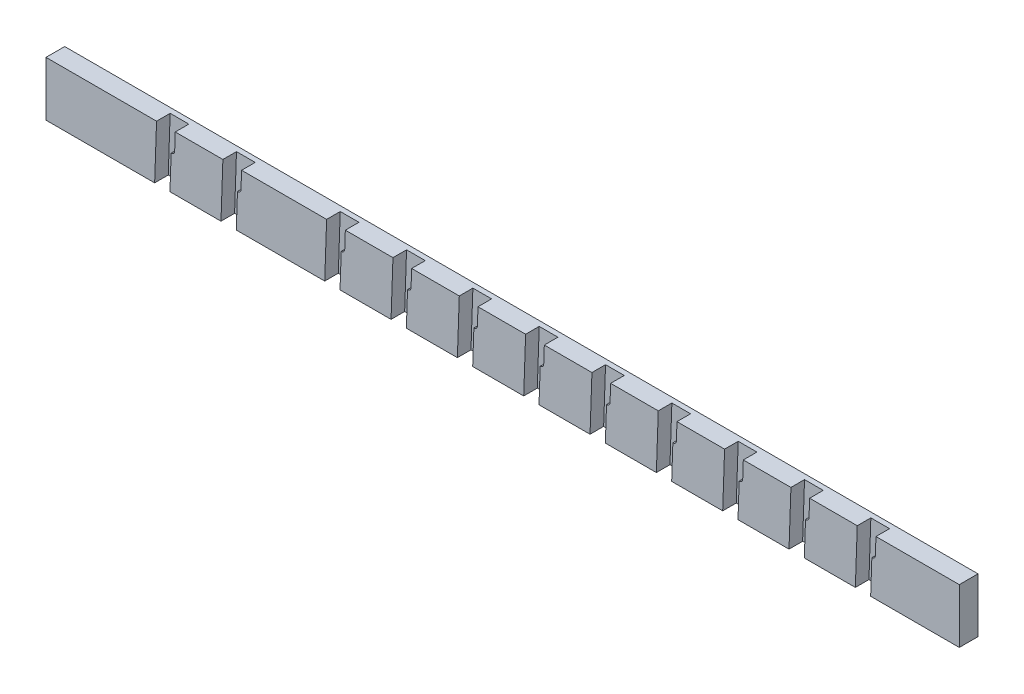
from build123d import *

# Parameters (mm, degrees)
SKETCH1_W           = 1704.975
SKETCH1_H           = 101.6
BOSS_EXTRUDE1_DEPTH = 34.925
CUT_EXTRUDE1_DEPTH  = 25.4


with BuildPart() as part:
    # Sketch1 → Boss-Extrude1 (new body)
    with BuildSketch(Plane.XY):
        Rectangle(SKETCH1_W, SKETCH1_H)
    extrude(amount=BOSS_EXTRUDE1_DEPTH)

    # Sketch2 → Cut-Extrude1 (cut)
    with BuildSketch(Plane.XY.offset(34.925)):
        with BuildLine():
            Line((658.43954982, -50.8), (687.01454982, -50.8))
            Line((687.01454982, -50.8), (689.232018682, 12.7))
            Line((689.232018682, 12.7), (689.449894962, 12.7))
            ThreePointArc((689.449894962, 12.7), (693.860975615, 14.482192268), (695.796026714, 18.828388196))
            Line((695.796026714, 18.828388196), (696.9125, 50.8))
            Line((696.9125, 50.8), (661.9875, 50.8))
            Line((661.9875, 50.8), (658.43954982, -50.8))
        make_face()
        with BuildLine():
            Line((534.61454982, -50.8), (563.18954982, -50.8))
            Line((563.18954982, -50.8), (565.407018682, 12.7))
            Line((565.407018682, 12.7), (565.624894962, 12.7))
            ThreePointArc((565.624894962, 12.7), (570.035975615, 14.482192268), (571.971026714, 18.828388196))
            Line((571.971026714, 18.828388196), (573.0875, 50.8))
            Line((573.0875, 50.8), (538.1625, 50.8))
            Line((538.1625, 50.8), (534.61454982, -50.8))
        make_face()
        with BuildLine():
            Line((410.78954982, -50.8), (439.36454982, -50.8))
            Line((439.36454982, -50.8), (441.582018682, 12.7))
            Line((441.582018682, 12.7), (441.799894962, 12.7))
            ThreePointArc((441.799894962, 12.7), (446.210975615, 14.482192268), (448.146026714, 18.828388196))
            Line((448.146026714, 18.828388196), (449.2625, 50.8))
            Line((449.2625, 50.8), (414.3375, 50.8))
            Line((414.3375, 50.8), (410.78954982, -50.8))
        make_face()
        with BuildLine():
            Line((286.96454982, -50.8), (315.53954982, -50.8))
            Line((315.53954982, -50.8), (317.757018682, 12.7))
            Line((317.757018682, 12.7), (317.974894962, 12.7))
            ThreePointArc((317.974894962, 12.7), (322.385975615, 14.482192268), (324.321026714, 18.828388196))
            Line((324.321026714, 18.828388196), (325.4375, 50.8))
            Line((325.4375, 50.8), (290.5125, 50.8))
            Line((290.5125, 50.8), (286.96454982, -50.8))
        make_face()
        with BuildLine():
            Line((163.13954982, -50.8), (191.71454982, -50.8))
            Line((191.71454982, -50.8), (193.932018682, 12.7))
            Line((193.932018682, 12.7), (194.149894962, 12.7))
            ThreePointArc((194.149894962, 12.7), (198.560975615, 14.482192268), (200.496026714, 18.828388196))
            Line((200.496026714, 18.828388196), (201.6125, 50.8))
            Line((201.6125, 50.8), (166.6875, 50.8))
            Line((166.6875, 50.8), (163.13954982, -50.8))
        make_face()
        with BuildLine():
            Line((39.31454982, -50.8), (67.88954982, -50.8))
            Line((67.88954982, -50.8), (70.107018682, 12.7))
            Line((70.107018682, 12.7), (70.324894962, 12.7))
            ThreePointArc((70.324894962, 12.7), (74.735975615, 14.482192268), (76.671026714, 18.828388196))
            Line((76.671026714, 18.828388196), (77.7875, 50.8))
            Line((77.7875, 50.8), (42.8625, 50.8))
            Line((42.8625, 50.8), (39.31454982, -50.8))
        make_face()
        with BuildLine():
            Line((-84.51045018, -50.8), (-55.93545018, -50.8))
            Line((-55.93545018, -50.8), (-53.717981318, 12.7))
            Line((-53.717981318, 12.7), (-53.500105038, 12.7))
            ThreePointArc((-53.500105038, 12.7), (-49.089024385, 14.482192268), (-47.153973286, 18.828388196))
            Line((-47.153973286, 18.828388196), (-46.0375, 50.8))
            Line((-46.0375, 50.8), (-80.9625, 50.8))
            Line((-80.9625, 50.8), (-84.51045018, -50.8))
        make_face()
        with BuildLine():
            Line((-208.33545018, -50.8), (-179.76045018, -50.8))
            Line((-179.76045018, -50.8), (-177.542981318, 12.7))
            Line((-177.542981318, 12.7), (-177.325105038, 12.7))
            ThreePointArc((-177.325105038, 12.7), (-172.914024385, 14.482192268), (-170.978973286, 18.828388196))
            Line((-170.978973286, 18.828388196), (-169.8625, 50.8))
            Line((-169.8625, 50.8), (-204.7875, 50.8))
            Line((-204.7875, 50.8), (-208.33545018, -50.8))
        make_face()
        with BuildLine():
            Line((-332.16045018, -50.8), (-303.58545018, -50.8))
            Line((-303.58545018, -50.8), (-301.367981318, 12.7))
            Line((-301.367981318, 12.7), (-301.150105038, 12.7))
            ThreePointArc((-301.150105038, 12.7), (-296.739024385, 14.482192268), (-294.803973286, 18.828388196))
            Line((-294.803973286, 18.828388196), (-293.6875, 50.8))
            Line((-293.6875, 50.8), (-328.6125, 50.8))
            Line((-328.6125, 50.8), (-332.16045018, -50.8))
        make_face()
        with BuildLine():
            Line((-525.83545018, -50.8), (-497.26045018, -50.8))
            Line((-497.26045018, -50.8), (-495.042981318, 12.7))
            Line((-495.042981318, 12.7), (-494.825105038, 12.7))
            ThreePointArc((-494.825105038, 12.7), (-490.414024385, 14.482192268), (-488.478973286, 18.828388196))
            Line((-488.478973286, 18.828388196), (-487.3625, 50.8))
            Line((-487.3625, 50.8), (-522.2875, 50.8))
            Line((-522.2875, 50.8), (-525.83545018, -50.8))
        make_face()
        with BuildLine():
            Line((-649.66045018, -50.8), (-621.08545018, -50.8))
            Line((-621.08545018, -50.8), (-618.867981318, 12.7))
            Line((-618.867981318, 12.7), (-618.650105038, 12.7))
            ThreePointArc((-618.650105038, 12.7), (-614.239024385, 14.482192268), (-612.303973286, 18.828388196))
            Line((-612.303973286, 18.828388196), (-611.1875, 50.8))
            Line((-611.1875, 50.8), (-646.1125, 50.8))
            Line((-646.1125, 50.8), (-649.66045018, -50.8))
        make_face()
    extrude(amount=-CUT_EXTRUDE1_DEPTH, mode=Mode.SUBTRACT)


solid = part.part
